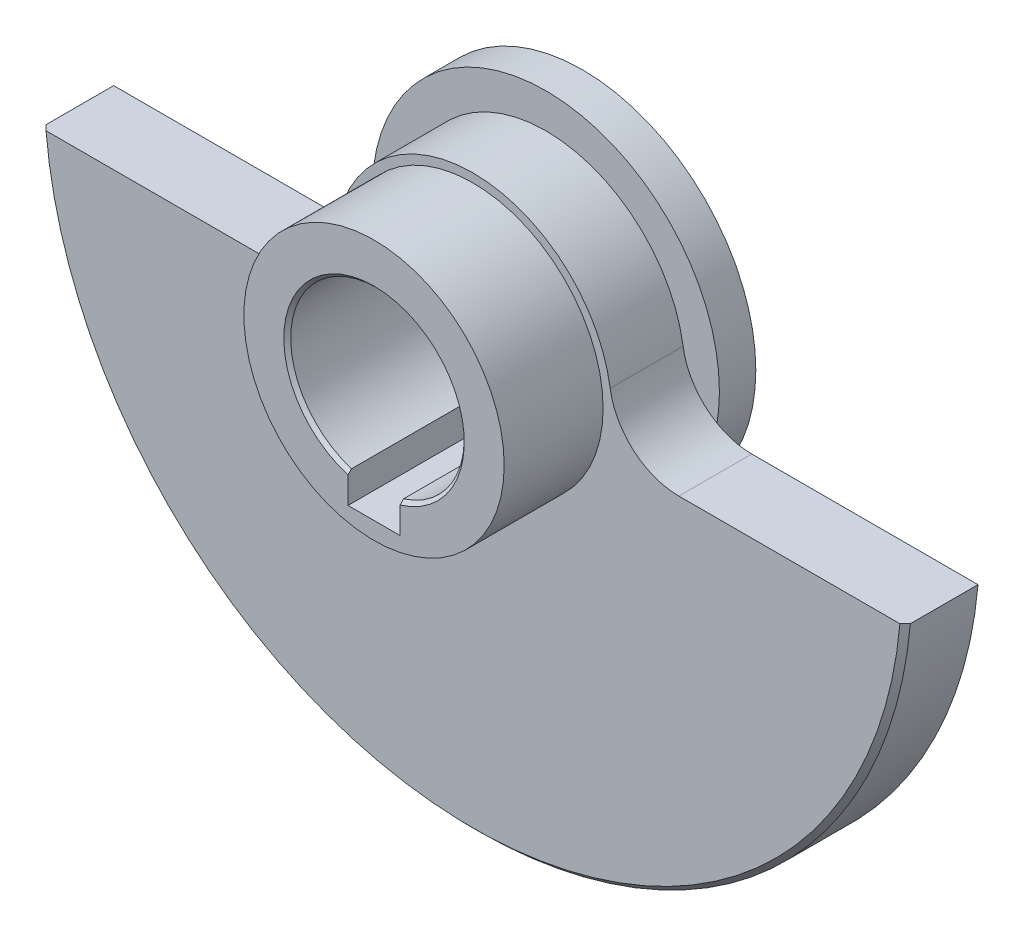
from build123d import *

# Parameters (mm, degrees)
JOIN1_START         = -4.2
JOIN1_OUTLINE_R     = 5
JOIN1_DEPTH         = 4.2
JOIN1_START_2       = -6.3
JOIN1_2_OUTLINE_R   = 7.5
JOIN1_2_OUTLINE_R_2 = 5
JOIN1_2_DEPTH       = 12
JOIN1_3_OUTLINE_R   = 10
JOIN1_3_OUTLINE_R_2 = 7.5
JOIN1_3_DEPTH       = 2.1
SKETCH1_W           = 3
SKETCH1_H           = 4.738081577
CUT_EXTRUDE1_DEPTH  = 38.271436785
SKETCH2_R           = 1.5
CUT_EXTRUDE2_DEPTH  = 1
CIRPATTERN1_COUNT   = 12
CHAMFER1_SIZE       = 0.2
CHAMFER2_SIZE       = 0.2
CHAMFER3_SIZE       = 0.3


# Read off the part's stored shape, not the designer's step: Join1
with BuildPart() as part:
    # Join1 outline → Join1 (new body)
    with BuildSketch(Plane.XY.offset(JOIN1_START)):
        with BuildLine():
            ThreePointArc((-24.903011866, -2.2), (0, -25), (24.903011866, -2.2))
            Line((24.903011866, -2.2), (11.86423196, -2.2))
            ThreePointArc((11.86423196, -2.2), (9.256550998, -1.233150178), (7.909487973, 1.2))
            ThreePointArc((7.909487973, 1.2), (0, 8), (-7.909487973, 1.2))
            ThreePointArc((-7.909487973, 1.2), (-9.256550998, -1.233150178), (-11.86423196, -2.2))
            Line((-11.86423196, -2.2), (-24.903011866, -2.2))
        make_face()
        Circle(JOIN1_OUTLINE_R, mode=Mode.SUBTRACT)
    extrude(amount=JOIN1_DEPTH)

    # Join1 2 outline → Join1 2 (add)
    with BuildSketch(Plane.XY.offset(JOIN1_START_2)):
        Circle(JOIN1_2_OUTLINE_R)
        Circle(JOIN1_2_OUTLINE_R_2, mode=Mode.SUBTRACT)
    extrude(amount=JOIN1_2_DEPTH)

    # Join1 3 outline → Join1 3 (add)
    with BuildSketch(Plane.XY.offset(JOIN1_START_2)):
        Circle(JOIN1_3_OUTLINE_R)
        Circle(JOIN1_3_OUTLINE_R_2, mode=Mode.SUBTRACT)
    extrude(amount=JOIN1_3_DEPTH)

    # Sketch1 → Cut-Extrude1 (cut, through all)
    with BuildSketch(Plane.XY.offset(5.7)):
        with Locations((0, -4.130959212)):
            Rectangle(SKETCH1_W, SKETCH1_H)
    extrude(amount=-CUT_EXTRUDE1_DEPTH, mode=Mode.SUBTRACT)

    # Sketch2 → Cut-Extrude2 (cut)
    with BuildSketch(Plane(origin=(0, 0, -6.3), x_dir=(-1, 0, 0), z_dir=(0, 0, -1))):
        with Locations((-7.5, 0)):
            Circle(SKETCH2_R)
    cut_extrude2 = extrude(amount=-CUT_EXTRUDE2_DEPTH, mode=Mode.SUBTRACT)

    # CirPattern1: Cut-Extrude2 ×12 about axis
    cirpattern1_axis = Axis((0, 0, 0), (0, 0, 1))
    for i in range(1, CIRPATTERN1_COUNT):
        add(cut_extrude2.rotate(cirpattern1_axis, i * 360 / CIRPATTERN1_COUNT), mode=Mode.SUBTRACT)

    # Chamfer1
    chamfer1_edges = [part.edges().sort_by_distance(p)[0] for p in [
        (0, 5, 5.7),
    ]]
    chamfer(chamfer1_edges, length=CHAMFER1_SIZE)

    # Chamfer2
    chamfer2_edges = [part.edges().sort_by_distance(p)[0] for p in [
        (0, 5, -6.3),
    ]]
    chamfer(chamfer2_edges, length=CHAMFER2_SIZE)

    # Chamfer3
    chamfer3_edges = [part.edges().sort_by_distance(p)[0] for p in [
        (0, -25, 0),
    ]]
    chamfer(chamfer3_edges, length=CHAMFER3_SIZE)


solid = part.part
